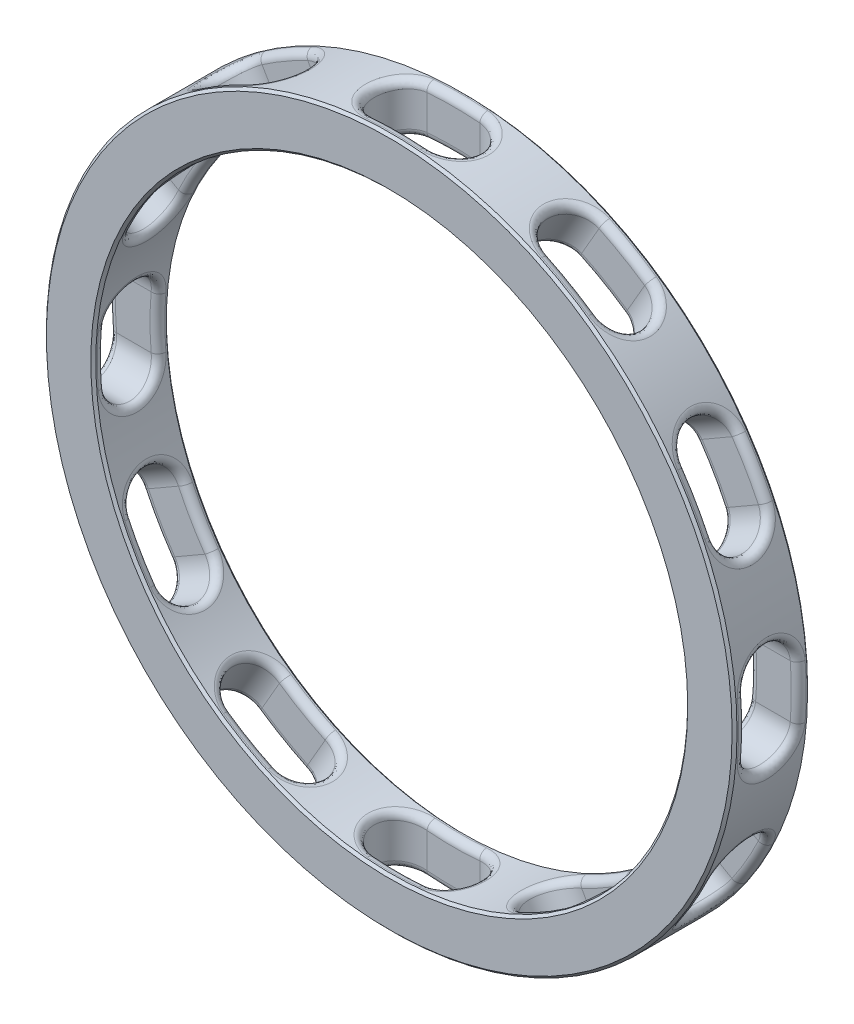
from build123d import *

# Parameters (mm, degrees)
SKETCH2_R                = 35
SKETCH2_R_2              = 30
EXTRUDE_THIN1_DEPTH      = 3.825
CUT_EXTRUDE1_DEPTH       = 50.645046329
FILLET1_R                = 0.75
CHAMFER1_SIZE            = 0.25
CIRPATTERN1_COUNT        = 12
FILLET1_OF_CIRPATTERN1_R = 0.75


with BuildPart() as part:
    # Sketch2 → Extrude-Thin1 (new, symmetric)
    with BuildSketch(Plane.XY):
        Circle(SKETCH2_R)
        Circle(SKETCH2_R_2, mode=Mode.SUBTRACT)
    extrude(amount=EXTRUDE_THIN1_DEPTH, both=True)

    # Sketch3 → Cut-Extrude1 (cut, through all)
    with BuildSketch(Plane(origin=(0, 0, 0), x_dir=(1, 0, 0), z_dir=(0, 1, 0))):
        with BuildLine():
            Line((2.675, -2.675), (-2.675, -2.675))
            ThreePointArc((-2.675, -2.675), (-5.35, 0), (-2.675, 2.675))
            Line((-2.675, 2.675), (2.675, 2.675))
            ThreePointArc((2.675, 2.675), (5.35, 0), (2.675, -2.675))
        make_face()
    cut_extrude1 = extrude(amount=-CUT_EXTRUDE1_DEPTH, mode=Mode.SUBTRACT)

    # Fillet1
    fillet1_edges = [part.edges().sort_by_distance(p)[0] for p in [
        (0, -35, 2.675),
        (-5.35, -34.588690348, 0),
        (0, -35, -2.675),
        (0, -30, 2.675),
        (-5.35, -29.519103984, 0),
        (0, -30, -2.675),
        (5.35, -34.588690348, 0),
        (5.35, -29.519103984, 0),
    ]]
    fillet(fillet1_edges, radius=FILLET1_R)

    # Chamfer1
    chamfer1_edges = [part.edges().sort_by_distance(p)[0] for p in [
        (-35, 0, -3.825),
        (-35, 0, 3.825),
        (-30, 0, -3.825),
        (-30, 0, 3.825),
    ]]
    chamfer(chamfer1_edges, length=CHAMFER1_SIZE)

    # CirPattern1: Cut-Extrude1 ×12 about axis
    cirpattern1_axis = Axis((0, 0, 3.825), (0, 0, -1))
    for i in range(1, CIRPATTERN1_COUNT):
        add(cut_extrude1.rotate(cirpattern1_axis, i * 360 / CIRPATTERN1_COUNT), mode=Mode.SUBTRACT)

    # Fillet1 of CirPattern1
    fillet1_of_cirpattern1_edges = [part.edges().sort_by_distance(p)[0] for p in [
        (-17.5, -30.310889132, 2.675),
        (-21.927581084, -27.279684525, 0),
        (-17.5, -30.310889132, -2.675),
        (-15, -25.980762114, 2.675),
        (-19.392787902, -22.889293947, 0),
        (-15, -25.980762114, -2.675),
        (-12.661109264, -32.629684525, 0),
        (-10.126316082, -28.239293947, 0),
        (-30.310889132, -17.5, 2.675),
        (-32.629684525, -12.661109264, 0),
        (-30.310889132, -17.5, -2.675),
        (-25.980762114, -15, 2.675),
        (-28.239293947, -10.126316082, 0),
        (-25.980762114, -15, -2.675),
        (-27.279684525, -21.927581084, 0),
        (-22.889293947, -19.392787902, 0),
        (-35, 0, 2.675),
        (-34.588690348, 5.35, 0),
        (-35, 0, -2.675),
        (-30, 0, 2.675),
        (-29.519103984, 5.35, 0),
        (-30, 0, -2.675),
        (-34.588690348, -5.35, 0),
        (-29.519103984, -5.35, 0),
        (-30.310889132, 17.5, 2.675),
        (-27.279684525, 21.927581084, 0),
        (-30.310889132, 17.5, -2.675),
        (-25.980762114, 15, 2.675),
        (-22.889293947, 19.392787902, 0),
        (-25.980762114, 15, -2.675),
        (-32.629684525, 12.661109264, 0),
        (-28.239293947, 10.126316082, 0),
        (-17.5, 30.310889132, 2.675),
        (-12.661109264, 32.629684525, 0),
        (-17.5, 30.310889132, -2.675),
        (-15, 25.980762114, 2.675),
        (-10.126316082, 28.239293947, 0),
        (-15, 25.980762114, -2.675),
        (-21.927581084, 27.279684525, 0),
        (-19.392787902, 22.889293947, 0),
        (0, 35, 2.675),
        (5.35, 34.588690348, 0),
        (0, 35, -2.675),
        (0, 30, 2.675),
        (5.35, 29.519103984, 0),
        (0, 30, -2.675),
        (-5.35, 34.588690348, 0),
        (-5.35, 29.519103984, 0),
        (17.5, 30.310889132, 2.675),
        (21.927581084, 27.279684525, 0),
        (17.5, 30.310889132, -2.675),
        (15, 25.980762114, 2.675),
        (19.392787902, 22.889293947, 0),
        (15, 25.980762114, -2.675),
        (12.661109264, 32.629684525, 0),
        (10.126316082, 28.239293947, 0),
        (30.310889132, 17.5, 2.675),
        (32.629684525, 12.661109264, 0),
        (30.310889132, 17.5, -2.675),
        (25.980762114, 15, 2.675),
        (28.239293947, 10.126316082, 0),
        (25.980762114, 15, -2.675),
        (27.279684525, 21.927581084, 0),
        (22.889293947, 19.392787902, 0),
        (35, 0, 2.675),
        (34.588690348, -5.35, 0),
        (35, 0, -2.675),
        (30, 0, 2.675),
        (29.519103984, -5.35, 0),
        (30, 0, -2.675),
        (34.588690348, 5.35, 0),
        (29.519103984, 5.35, 0),
        (30.310889132, -17.5, 2.675),
        (27.279684525, -21.927581084, 0),
        (30.310889132, -17.5, -2.675),
        (25.980762114, -15, 2.675),
        (22.889293947, -19.392787902, 0),
        (25.980762114, -15, -2.675),
        (32.629684525, -12.661109264, 0),
        (28.239293947, -10.126316082, 0),
        (17.5, -30.310889132, 2.675),
        (12.661109264, -32.629684525, 0),
        (17.5, -30.310889132, -2.675),
        (15, -25.980762114, 2.675),
        (10.126316082, -28.239293947, 0),
        (15, -25.980762114, -2.675),
        (21.927581084, -27.279684525, 0),
        (19.392787902, -22.889293947, 0),
    ]]
    fillet(fillet1_of_cirpattern1_edges, radius=FILLET1_OF_CIRPATTERN1_R)


solid = part.part
